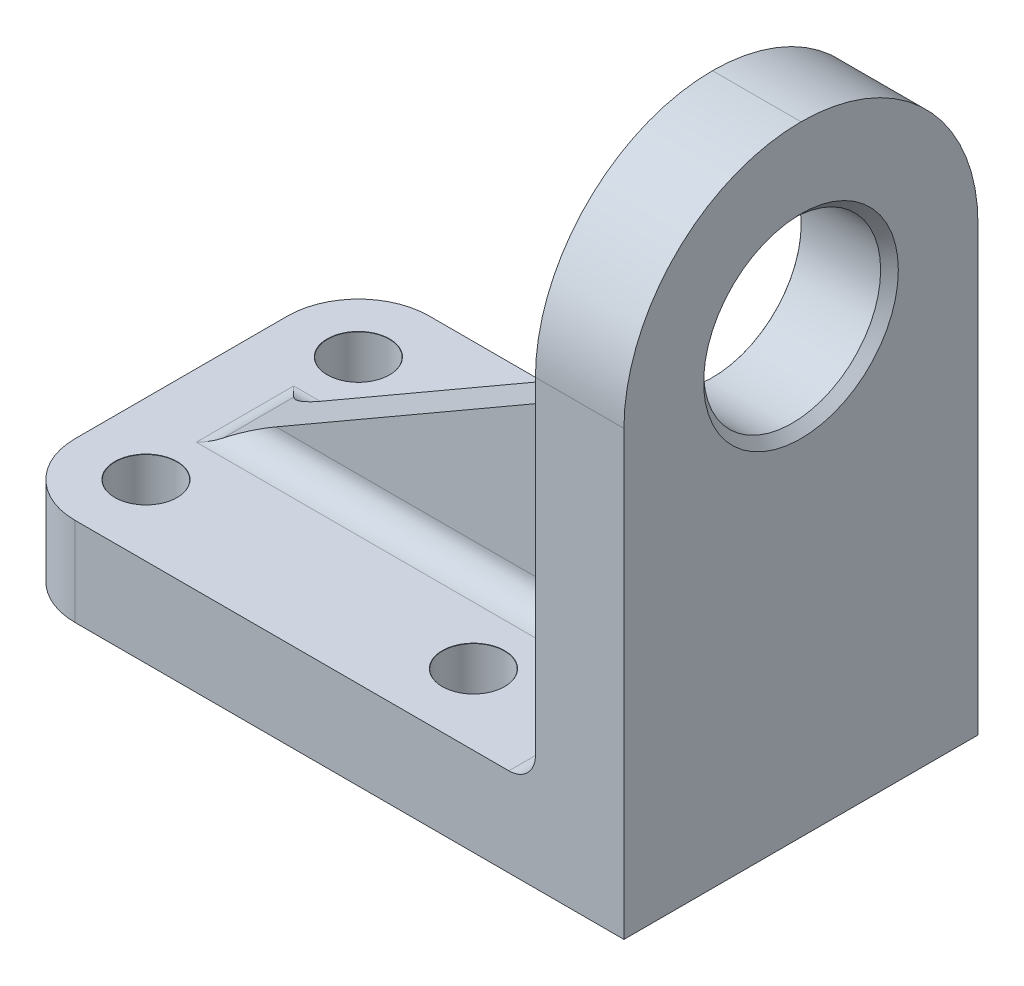
from build123d import *

# Parameters (mm, degrees)
RESSALTO_EXTRUS_O1_DEPTH             = 20
FILETE1_R                            = 8
FILETE2_R                            = 20
FILETE3_R                            = 3
NERVURA23_START                      = -2.5
NERVURA23_DEPTH                      = 5
FILETE4_R                            = 3
FURO_DE_DI_METRO_7_0_7_1_D           = 7
FURO_DE_DI_METRO_7_0_7_1_CSINK_D     = 7.05
FURO_DE_DI_METRO_7_0_7_1_CSINK_ANGLE = 90


# Read off the part's stored shape, not the designer's step: Nervura23
with BuildPart() as part:
    # Esboço1 → Ressalto-extrusão1 (new, symmetric)
    with BuildSketch(Plane.XY):
        Polygon((0, 0), (70, 0), (70, 70), (60, 70), (60, 10), (0, 10), align=None)
    extrude(amount=RESSALTO_EXTRUS_O1_DEPTH, both=True)

    # Filete1
    filete1_edges = [part.edges().sort_by_distance(p)[0] for p in [
        (0, 5, -20),
        (0, 5, 20),
    ]]
    fillet(filete1_edges, radius=FILETE1_R)

    # Filete2
    filete2_edges = [part.edges().sort_by_distance(p)[0] for p in [
        (65, 70, 20),
        (65, 70, -20),
    ]]
    fillet(filete2_edges, radius=FILETE2_R - 0.0001)  # a hair under: the kernel refuses the full size

    # Filete3
    filete3_edges = [part.edges().sort_by_distance(p)[0] for p in [
        (60, 10, 0),
    ]]
    fillet(filete3_edges, radius=FILETE3_R)

    # Nervura23 outline → Nervura23 (add)
    with BuildSketch(Plane.XY.offset(NERVURA23_START)):
        with BuildLine():
            Line((60, 35), (51.301270189, 35))
            Line((51.301270189, 35), (8, 10))
            Line((8, 10), (57, 10))
            ThreePointArc((57, 10), (59.121320344, 10.878679656), (60, 13))
            Line((60, 13), (60, 35))
        make_face()
    extrude(amount=NERVURA23_DEPTH)

    # Filete4
    filete4_edges = [part.edges().sort_by_distance(p)[0] for p in [
        (59.121320344, 10.878679656, -2.5),
        (59.121320344, 10.878679656, 2.5),
        (8, 10, 0),
        (60, 35, 0),
        (32.5, 10, -2.5),
        (60, 24, -2.5),
        (32.5, 10, 2.5),
        (60, 24, 2.5),
    ]]
    fillet(filete4_edges, radius=FILETE4_R)

    # Furo de diâmetro Ø7.0 (7)1 (through all)
    with Locations(Plane(origin=(0, 10, 0), x_dir=(1, 0, 0), z_dir=(0, 1, 0))):
        with Locations((8, 12), (8, -12), (45, 12), (45, -12)):
            CounterSinkHole(FURO_DE_DI_METRO_7_0_7_1_D / 2, FURO_DE_DI_METRO_7_0_7_1_CSINK_D / 2, counter_sink_angle=FURO_DE_DI_METRO_7_0_7_1_CSINK_ANGLE)

    # Esboço11 → Furo de diâmetro Ø20.0 (20)1 (revolve, cut)
    with BuildSketch(Plane(origin=(70, 50, 0), x_dir=(0, 0, -1), z_dir=(0, 1, 0))):
        Polygon((0, 0), (0, 10), (10.025, 10), (10, 9.975), (10, 1), (11, 0), align=None)
    revolve(axis=Axis((76.35, 50, 0), (-1, 0, 0)), mode=Mode.SUBTRACT)


solid = part.part
